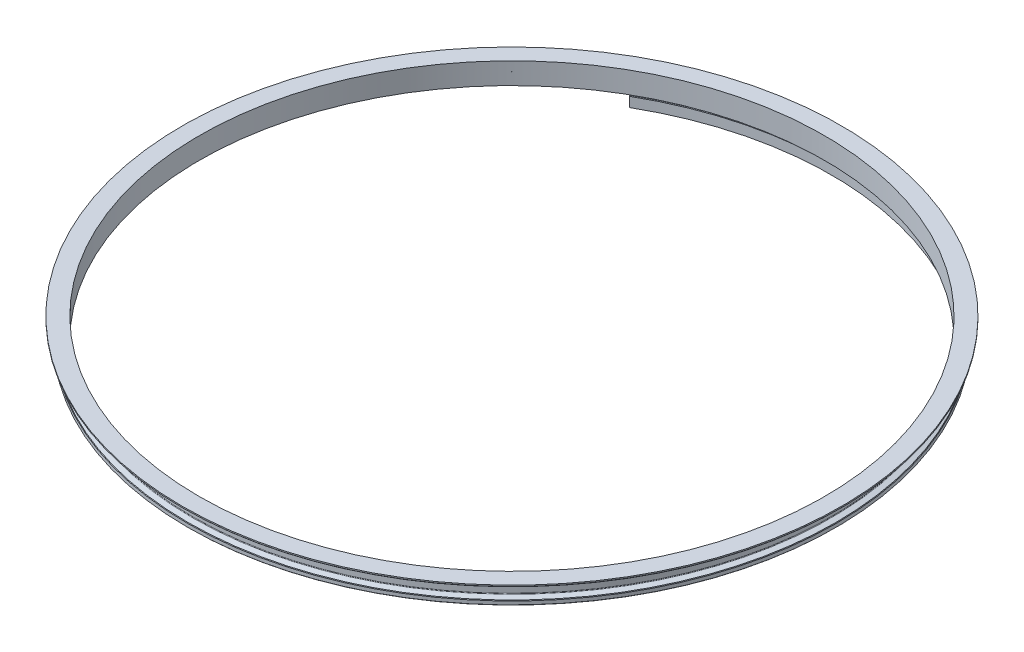
from build123d import *
from OCP.BRepFilletAPI import BRepFilletAPI_MakeChamfer

# Parameters (mm, degrees)
SKETCH3_W          = 160.655
SKETCH3_H          = 0.381
CUT_EXTRUDE1_DEPTH = 229.066769066
CIRPATTERN2_START  = -9.401919884
CIRPATTERN2_DEPTH  = 18.803839768
FILLET1_R          = 0.508
CHAMFER6_SIZE      = 0.254
CHAMFER6_SIZE2     = 0.197576926
CHAMFER5_SIZE      = 0.254
CHAMFER5_SIZE2     = 0.253699349
CHAMFER2_SIZE      = 1.5
CHAMFER2_SIZE2     = 3.8
FILLET2_R          = 0.3175
CHAMFER4_SIZE      = 0.254
CHAMFER7_SIZE      = 0.254
CHAMFER7_SIZE2     = 0.197576926
CIRPATTERN5_COUNT  = 6


# Read off the part's stored shape, not the designer's step: moduleRing, CirPattern2, Mirror10
with BuildPart() as part:
    # moduleRing outline → moduleRing (revolve)
    with BuildSketch(Plane.XY):
        Polygon((152.4, 10.457412986), (152.4, 0), (158.0275, 0), (158.0275, 2.145588094), (155.4, 3.101919884), (155.4, 9.601919884), (160.655, 9.601919884), (160.655, 10.457412986), align=None)
    revolve(axis=Axis((0, 0, 0), (0, 1, 0)))

    # Fillet2
    fillet2_edges = [part.edges().sort_by_distance(p)[0] for p in [
        (-155.4, 9.601919884, 0),
        (-155.4, 3.101919884, 0),
    ]]
    fillet(fillet2_edges, radius=FILLET2_R)

    # Chamfer4
    chamfer4_edges = [part.edges().sort_by_distance(p)[0] for p in [
        (-160.655, 9.601919884, 0),
        (-158.0275, 0, 0),
    ]]
    chamfer(chamfer4_edges, length=CHAMFER4_SIZE)

    # Chamfer7
    chamfer7_edges = [part.edges().sort_by_distance(p)[0] for p in [
        (-158.0275, 2.145588094, 0),
    ]]
    chamfer7_side = [part.faces().sort_by_distance(p)[0] for p in [
        (-158.0275, 1.199794047, 0),
    ]]
    chamfer(chamfer7_edges, length=CHAMFER7_SIZE, length2=CHAMFER7_SIZE2, reference=chamfer7_side[0])

    # Sketch19 → Ø0.15 (0.15) Diameter Hole2 (revolve, cut)
    with BuildSketch(Plane(origin=(39.115322286, 5.801919884, -145.980370127), x_dir=(0.9659258262890699, 0, 0.25881904510251463), z_dir=(0, 1, 0))):
        Polygon((0, 0), (0, 5.245064546), (0.075, 5.2), (0.075, 0), align=None)
    f_0_15_0_15_diameter_hole2 = revolve(axis=Axis((37.47182135, 5.801919884, -139.84674113), (0.25881904510251474, 0, -0.9659258262890699)), mode=Mode.SUBTRACT)

    # Mirror8: Ø0.15 (0.15) Diameter Hole2 across plane
    add(f_0_15_0_15_diameter_hole2.mirror(Plane(origin=(0, 0, 0), x_dir=(0, 0, 1), z_dir=(1, 0, 0))), mode=Mode.SUBTRACT)

    # CirPattern5: Ø0.15 (0.15) Diameter Hole2 ×6 about axis
    cirpattern5_axis = Axis((0, 47.75171456, 0), (0, 1, 0))
    for i in range(1, CIRPATTERN5_COUNT):
        add(f_0_15_0_15_diameter_hole2.rotate(cirpattern5_axis, i * 360 / CIRPATTERN5_COUNT), mode=Mode.SUBTRACT)

    # CirPattern5 copy 1 sketch → CirPattern5 copy 1 (revolve, cut)
    with BuildSketch(Plane(origin=(-145.980370127, 5.801919884, -39.115322286), x_dir=(-0.25881904510252696, 0, 0.9659258262890666), z_dir=(0, 1, 0))):
        Polygon((0, 0), (0, -5.245064546), (0.075, -5.2), (0.075, 0), align=None)
    revolve(axis=Axis((-139.84674113, 5.801919884, -37.47182135), (0.9659258262890666, 0, 0.2588190451025269)), mode=Mode.SUBTRACT)

    # CirPattern5 copy 2 sketch → CirPattern5 copy 2 (revolve, cut)
    with BuildSketch(Plane(origin=(-106.865047841, 5.801919884, 106.865047841), x_dir=(0.7071067811865428, 0, 0.7071067811865521), z_dir=(0, 1, 0))):
        Polygon((0, 0), (0, -5.245064546), (0.075, -5.2), (0.075, 0), align=None)
    revolve(axis=Axis((-102.37491978, 5.801919884, 102.37491978), (0.7071067811865521, 0, -0.7071067811865429)), mode=Mode.SUBTRACT)

    # CirPattern5 copy 3 sketch → CirPattern5 copy 3 (revolve, cut)
    with BuildSketch(Plane(origin=(39.115322286, 5.801919884, 145.980370127), x_dir=(0.9659258262890699, 0, -0.2588190451025145), z_dir=(0, 1, 0))):
        Polygon((0, 0), (0, -5.245064546), (0.075, -5.2), (0.075, 0), align=None)
    revolve(axis=Axis((37.47182135, 5.801919884, 139.84674113), (-0.25881904510251463, 0, -0.9659258262890699)), mode=Mode.SUBTRACT)

    # CirPattern5 copy 4 sketch → CirPattern5 copy 4 (revolve, cut)
    with BuildSketch(Plane(origin=(145.980370127, 5.801919884, 39.115322286), x_dir=(0.2588190451025274, 0, -0.9659258262890664), z_dir=(0, 1, 0))):
        Polygon((0, 0), (0, -5.245064546), (0.075, -5.2), (0.075, 0), align=None)
    revolve(axis=Axis((139.84674113, 5.801919884, 37.47182135), (-0.9659258262890665, 0, -0.2588190451025273)), mode=Mode.SUBTRACT)

    # CirPattern5 copy 5 sketch → CirPattern5 copy 5 (revolve, cut)
    with BuildSketch(Plane(origin=(106.865047841, 5.801919884, -106.865047841), x_dir=(-0.7071067811865431, 0, -0.7071067811865519), z_dir=(0, 1, 0))):
        Polygon((0, 0), (0, -5.245064546), (0.075, -5.2), (0.075, 0), align=None)
    revolve(axis=Axis((102.37491978, 5.801919884, -102.37491978), (-0.7071067811865519, 0, 0.7071067811865432)), mode=Mode.SUBTRACT)


with BuildPart() as body_2:
    # Sketch1<5> → clampArc (revolve)
    with BuildSketch(Plane.XY, mode=Mode.PRIVATE) as clamparc_sk:
        Polygon((155.8, 9.401919884), (155.8, 2.956331791), (158.4275, 2), (158.4275, -2), (155.8, -2.956331791), (155.8, -9.401919884), (160.655, -9.401919884), (160.655, 9.401919884), align=None)
    revolve(clamparc_sk.sketch.rotate(Axis((0, 47.75171456, 0), (0, -1, 0)), 90), axis=Axis((0, 47.75171456, 0), (0, -1, 0)))

    # Sketch3 → Cut-Extrude1 (cut, symmetric)
    with BuildSketch(Plane.XZ.offset(9.401919884)):
        with Locations((80.3275, 0)):
            Rectangle(SKETCH3_W, SKETCH3_H)
    extrude(amount=CUT_EXTRUDE1_DEPTH, both=True, mode=Mode.SUBTRACT)

    # CirPattern2 outline → CirPattern2 (cut)
    with BuildSketch(Plane(origin=(0, 0, 0), x_dir=(1, 0, 0), z_dir=(0, 1, 0)).offset(CIRPATTERN2_START)):
        with BuildLine():
            ThreePointArc((160.654887055, 0.1905), (139.035963432, 80.492421367), (80.162465688, 139.226463432))
            Line((80.162465688, 139.226463432), (77.734963928, 135.021907049))
            ThreePointArc((77.734963928, 135.021907049), (134.831407049, 78.064919608), (155.799883536, 0.1905))
            Line((155.799883536, 0.1905), (160.654887055, 0.1905))
        make_face()
        with BuildLine():
            ThreePointArc((-80.162465688, 139.226463432), (-80.492421367, -139.035963432), (160.654887055, -0.1905))
            Line((160.654887055, -0.1905), (155.799883536, -0.1905))
            ThreePointArc((155.799883536, -0.1905), (-78.064919607, -134.831407049), (-77.734963928, 135.021907049))
            Line((-77.734963928, 135.021907049), (-80.162465688, 139.226463432))
        make_face()
    extrude(amount=CIRPATTERN2_DEPTH, mode=Mode.SUBTRACT)

    # Fillet1
    fillet1_edges = [body_2.edges().sort_by_distance(p)[0] for p in [
        (0, 2, -158.4275),
        (0, -2, -158.4275),
    ]]
    fillet(fillet1_edges, radius=FILLET1_R)

    # Chamfer6: one chamfer whose edges measure the first distance from different faces: ONE call of the kernel's chamfer builder (chamfer() names one face for all edges)
    chamfer6_edges_1 = [body_2.edges().sort_by_distance(p)[0] for p in [
        (0, -2.956331791, -155.8),
    ]]
    chamfer6_side_1 = [body_2.faces().sort_by_distance(p)[0] for p in [
        (0, -2.538995106, -156.946623116),
    ]]
    chamfer6_edges_2 = [body_2.edges().sort_by_distance(p)[0] for p in [
        (0, 2.956331791, -155.8),
    ]]
    chamfer6_side_2 = [body_2.faces().sort_by_distance(p)[0] for p in [
        (0, 6.179125837, -155.8),
    ]]
    chamfer6 = BRepFilletAPI_MakeChamfer(body_2.part.solid().wrapped)
    for e in chamfer6_edges_1:
        chamfer6.Add(CHAMFER6_SIZE, CHAMFER6_SIZE2, e.wrapped, chamfer6_side_1[0].wrapped)  # the first distance lies on this face
    for e in chamfer6_edges_2:
        chamfer6.Add(CHAMFER6_SIZE, CHAMFER6_SIZE2, e.wrapped, chamfer6_side_2[0].wrapped)  # the first distance lies on this face
    add(Compound.cast(chamfer6.Shape()), mode=Mode.REPLACE)

    # Sketch17 → Ø0.15 (0.15) Diameter Hole1 (revolve, cut)
    with BuildSketch(Plane(origin=(41.580573691, -5.801919884, -155.180813622), x_dir=(-0.9659258262890681, 0, -0.2588190451025214), z_dir=(0, 1, 0))):
        Polygon((0, 0), (0, 5.245064546), (0.075, 5.2), (0.075, 0), align=None)
    f_0_15_0_15_diameter_hole1 = revolve(axis=Axis((43.224074627, -5.801919884, -161.314442619), (-0.2588190451025214, 0, 0.9659258262890682)), mode=Mode.SUBTRACT)

    # Mirror5: Ø0.15 (0.15) Diameter Hole1 across plane
    add(f_0_15_0_15_diameter_hole1.mirror(Plane.ZX), mode=Mode.SUBTRACT)

    # Mirror6: Ø0.15 (0.15) Diameter Hole1 across plane
    add(f_0_15_0_15_diameter_hole1.mirror(Plane(origin=(0, 0, 0), x_dir=(0, 0, 1), z_dir=(1, 0, 0))), mode=Mode.SUBTRACT)

    # Mirror6 copy 1 sketch → Mirror6 copy 1 (revolve, cut)
    with BuildSketch(Plane(origin=(-41.580573691, 5.801919884, -155.180813622), x_dir=(0.9659258262890681, 0, -0.2588190451025214), z_dir=(0, -1, 0))):
        Polygon((0, 0), (0, 5.245064546), (0.075, 5.2), (0.075, 0), align=None)
    revolve(axis=Axis((-43.224074627, 5.801919884, -161.314442619), (0.2588190451025214, 0, 0.9659258262890682)), mode=Mode.SUBTRACT)

    # Chamfer5: one chamfer whose edges measure the first distance from different faces: ONE call of the kernel's chamfer builder (chamfer() names one face for all edges)
    chamfer5_edges_1 = [body_2.edges().sort_by_distance(p)[0] for p in [
        (0, 9.401919884, -160.655),
        (0, -9.401919884, -160.655),
    ]]
    chamfer5_edges_2 = [body_2.edges().sort_by_distance(p)[0] for p in [
        (-80.162465688, 0, -139.226463432),
    ]]
    chamfer5_side_2 = [body_2.faces().sort_by_distance(p)[0] for p in [
        (-79.049147913, -7.604e-06, -137.298140481),
    ]]
    chamfer5_edges_3 = [body_2.edges().sort_by_distance(p)[0] for p in [
        (80.162465688, 0, -139.226463432),
    ]]
    chamfer5_side_3 = [body_2.faces().sort_by_distance(p)[0] for p in [
        (79.049147913, -7.604e-06, -137.298140481),
    ]]
    chamfer5 = BRepFilletAPI_MakeChamfer(body_2.part.solid().wrapped)
    for e in chamfer5_edges_1:
        chamfer5.Add(CHAMFER5_SIZE, e.wrapped)
    for e in chamfer5_edges_2:
        chamfer5.Add(CHAMFER5_SIZE, CHAMFER5_SIZE2, e.wrapped, chamfer5_side_2[0].wrapped)  # the first distance lies on this face
    for e in chamfer5_edges_3:
        chamfer5.Add(CHAMFER5_SIZE, CHAMFER5_SIZE2, e.wrapped, chamfer5_side_3[0].wrapped)  # the first distance lies on this face
    add(Compound.cast(chamfer5.Shape()), mode=Mode.REPLACE)

    # Chamfer2
    chamfer2_edges = [body_2.edges().sort_by_distance(p)[0] for p in [
        (0, -9.401919884, -155.8),
    ]]
    chamfer2_side = [body_2.faces().sort_by_distance(p)[0] for p in [
        (0, -6.277914294, -155.8),
    ]]
    chamfer(chamfer2_edges, length=CHAMFER2_SIZE, length2=CHAMFER2_SIZE2, reference=chamfer2_side[0])

    # Mirror10 outline → Mirror10 (revolve, cut)
    with BuildSketch(Plane.XY):
        Polygon((155.8, 9.401919884), (155.8, 7.901919884), (159.6, 9.401919884), align=None)
    revolve(axis=Axis((0, 0, 0), (0, 1, 0)), mode=Mode.SUBTRACT)


solid = Compound([part.part, body_2.part])
